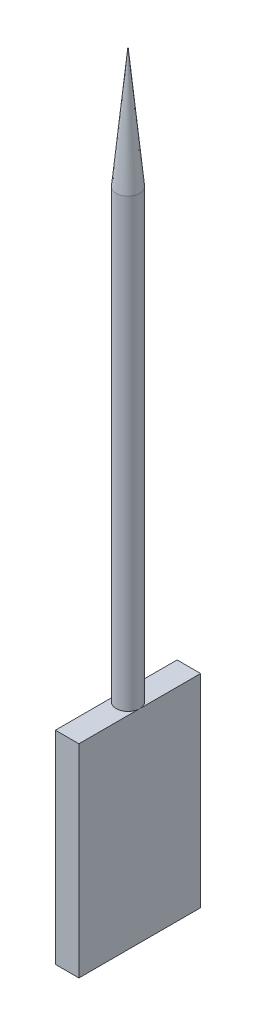
from build123d import *

# Parameters (mm, degrees)
SKETCH1_W           = 2.9
SKETCH1_H           = 15
BOSS_EXTRUDE1_DEPTH = 80
SKETCH2_W           = 6
SKETCH2_H           = 55
CUT_EXTRUDE1_DEPTH  = 80
CUT_EXTRUDE4_DEPTH  = 55


# Read off the part's stored shape, not the designer's step: Loft2
with BuildPart() as part:
    # Sketch1 → Boss-Extrude1 (new body)
    with BuildSketch(Plane(origin=(0, 0, 0), x_dir=(1, 0, 0), z_dir=(0, 1, 0))):
        Rectangle(SKETCH1_W, SKETCH1_H)
    extrude(amount=BOSS_EXTRUDE1_DEPTH)

    # Sketch2 → Cut-Extrude1 (cut)
    with BuildSketch(Plane(origin=(1.45, 0, 0), x_dir=(0, 0, -1), z_dir=(1, 0, 0))):
        with Locations((-4.5, 52.5)):
            Rectangle(SKETCH2_W, SKETCH2_H)
        with Locations((4.5, 52.5)):
            Rectangle(SKETCH2_W, SKETCH2_H)
    extrude(amount=-CUT_EXTRUDE1_DEPTH, mode=Mode.SUBTRACT)

    # Sketch3 → Cut-Extrude4 (cut)
    with BuildSketch(Plane(origin=(0, 80, 0), x_dir=(1, 0, 0), z_dir=(0, 1, 0))):
        with BuildLine():
            Line((-1.45, 1.5), (-1.45, 5e-09))
            ThreePointArc((-1.45, 5e-09), (3e-09, 1.45), (1.45, 0))
            Line((1.45, 0), (1.45, 1.5))
            Line((1.45, 1.5), (-1.45, 1.5))
        make_face()
        with BuildLine():
            Line((-1.45, 5e-09), (-1.45, -1.5))
            Line((-1.45, -1.5), (1.45, -1.5))
            Line((1.45, -1.5), (1.45, 0))
            ThreePointArc((1.45, 0), (-3e-09, -1.45), (-1.45, 5e-09))
        make_face()
    extrude(amount=-CUT_EXTRUDE4_DEPTH, mode=Mode.SUBTRACT)

    # Loft2 outline → Loft2 (revolve)
    with BuildSketch(Plane.XY):
        Polygon((1.45, 80), (0, 95), (0, 80), align=None)
    revolve(axis=Axis((0, 0, 0), (0, 1, 0)))


solid = part.part
